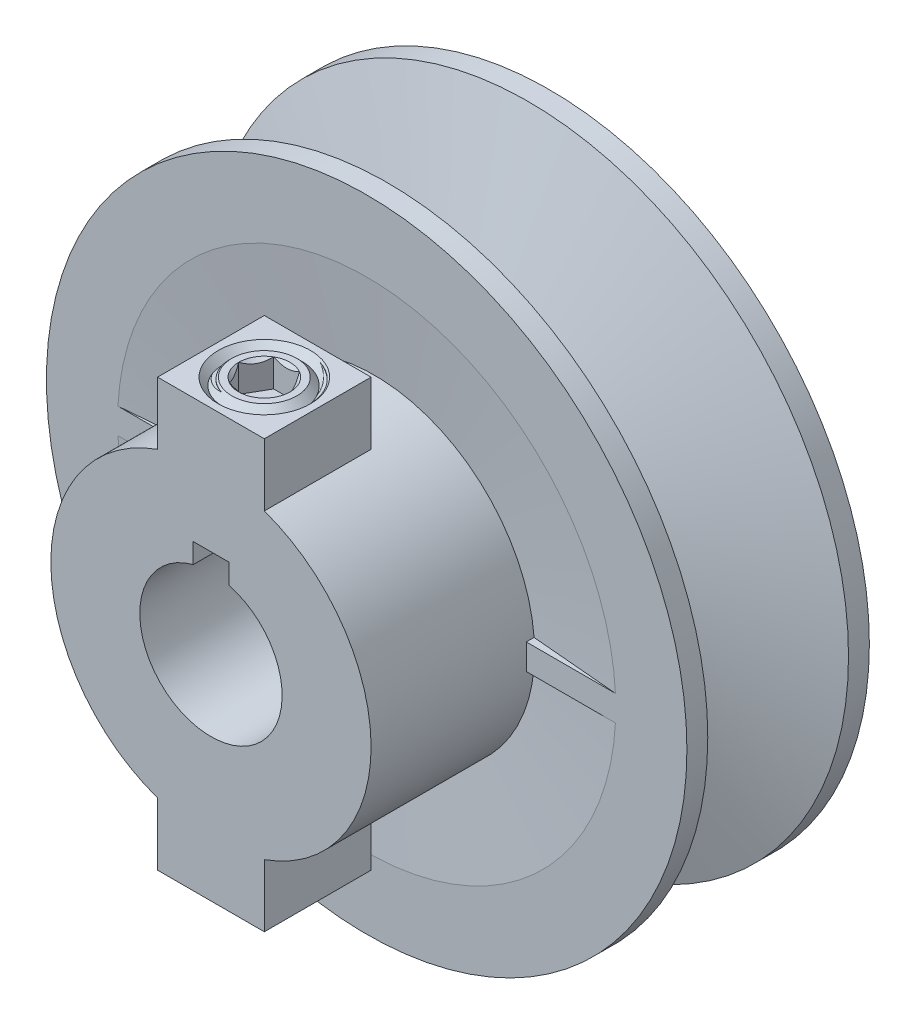
from build123d import *

# Parameters (mm, degrees)
BOSS_EXTRUDE1_DEPTH      = 1.143
CIRPATTERN1_COUNT        = 2
SKETCH3_R                = 6.35
CUT_EXTRUDE1_DEPTH       = 30.1752
BOSS_EXTRUDE2_REACH      = 62.791
BOSS_EXTRUDE2_END_RADIUS = 14.2875
BOSS_EXTRUDE2_START      = 4.7625
SKETCH5_W                = 9.525
SKETCH5_H                = 9.525
CUT_EXTRUDE3_REACH       = 61.751
CUT_EXTRUDE3_END_RADIUS  = 6.35
SKETCH6_R                = 3.0868055555555562
CUT_SWEEP1_PITCH         = 1.4111111111111094
CUT_SWEEP2_PITCH         = 1.4111111111111119
CUT_EXTRUDE5_DEPTH       = 2.48046875
SKETCH15_W               = 3.175
SKETCH15_H               = 2.980532838771275
CUT_EXTRUDE7_DEPTH       = 25.4


with BuildPart() as part:
    # Sketch1 → Revolve1 (revolve)
    with BuildSketch(Plane(origin=(0, 0, 0), x_dir=(0, 0, -1), z_dir=(1, 0, 0)), mode=Mode.PRIVATE) as revolve1_sk:
        Polygon((6.279294913631238, 28.575), (8.1407, 28.575000000000003), (8.1407, 22.225), (7.44625873326298, 14.287500000000003), (8.140700000000002, 14.2875), (8.140700000000004, 0), (-22.034499999999994, 0), (-22.03449999999999, 14.2875), (-7.746999999999997, 14.2875), (-7.446258733262977, 14.287500000000001), (-8.1407, 22.224999999999998), (-8.1407, 28.575), (-6.279294913631238, 28.575), (-2.3965152591062817, 15.875), (2.3965152591062844, 15.875), align=None)
    revolve(revolve1_sk.sketch.rotate(Axis((0, 0, 22.034499999999994), (0, 0, -1)), 90), axis=Axis((0, 0, 22.034499999999994), (0, 0, -1)))

    # Sketch2 → Boss-Extrude1 (add, symmetric)
    with BuildSketch(Plane(origin=(0, 0, 0), x_dir=(0, 0, -1), z_dir=(0, 1, 0))):
        Polygon((-7.4240366127273925, 14.033499999999998), (-8.1407, 22.225), (-8.1407, 14.0335), align=None)
        Polygon((8.1407, 14.0335), (7.4240366127273925, 14.033499999999998), (8.1407, 22.225), align=None)
    boss_extrude1 = extrude(amount=BOSS_EXTRUDE1_DEPTH, both=True)

    # CirPattern1: Boss-Extrude1 ×2 about axis
    cirpattern1_axis = Axis((0, 0, 0), (0, 0, -1))
    for i in range(1, CIRPATTERN1_COUNT):
        add(boss_extrude1.rotate(cirpattern1_axis, i * 360 / CIRPATTERN1_COUNT))

    # Sketch3 → Cut-Extrude1 (cut)
    with BuildSketch(Plane(origin=(0, 0, -8.1407), x_dir=(-1, 0, 0), z_dir=(0, 0, -1))):
        with Locations(Location((0, 2.6e-15, 0), (0, 0, 90))):
            Circle(SKETCH3_R)
    extrude(amount=-CUT_EXTRUDE1_DEPTH, mode=Mode.SUBTRACT)

    # Boss-Extrude2: up to this cylinder (the profile starts outside it)
    boss_extrude2_end = Plane(origin=(0, 0, 17.272), z_dir=(0, 0, 1)) * Cylinder(BOSS_EXTRUDE2_END_RADIUS, 155.15699999999998, mode=Mode.PRIVATE)
    # Sketch5 → Boss-Extrude2 (add, up to the surface)
    with BuildSketch(Plane(origin=(0, 14.2875, 0), x_dir=(-1, 0, 0), z_dir=(0, 1, 0)).offset(BOSS_EXTRUDE2_START), mode=Mode.PRIVATE) as boss_extrude2_sk1:
        with Locations((0, 17.271999999999995)):
            Rectangle(SKETCH5_W, SKETCH5_H)
    boss_extrude2_tool1 = extrude(boss_extrude2_sk1.sketch, amount=-BOSS_EXTRUDE2_REACH, mode=Mode.PRIVATE) - boss_extrude2_end
    boss_extrude2 = boss_extrude2_tool1.solids().sort_by_distance((0, 19.05, 17.272))[0]
    add(boss_extrude2)

    # Mirror1: Boss-Extrude2 across plane
    add(boss_extrude2.mirror(Plane.ZX))

    # Cut-Extrude3: up to this cylinder (the profile starts outside it)
    cut_extrude3_end = Plane(origin=(0, 2.6e-15, 17.272), z_dir=(0, 0, -1)) * Cylinder(CUT_EXTRUDE3_END_RADIUS, 137.202, mode=Mode.PRIVATE)
    # Sketch6 → Cut-Extrude3 (cut, up to the surface)
    with BuildSketch(Plane(origin=(0, 19.05, 0), x_dir=(-1, 0, 0), z_dir=(0, 1, 0)), mode=Mode.PRIVATE) as cut_extrude3_sk1:
        with Locations(Location((0, 17.271999999999995, 0), (0, 0, 90))):
            Circle(SKETCH6_R)
    cut_extrude3_tool1 = extrude(cut_extrude3_sk1.sketch, amount=-CUT_EXTRUDE3_REACH, mode=Mode.PRIVATE) - cut_extrude3_end
    add(cut_extrude3_tool1.solids().sort_by_distance((0, 19.05, 17.272))[0], mode=Mode.SUBTRACT)

    # Cut-Sweep1: arcs per turn and ends read off the stored shape
    # Cut-Sweep1: the profile of Sketch8 screwed along a right-hand helix through 11.125 turns, 8 arcs to a turn; built about Z, then put on its axis
    cut_sweep1_z = Axis((0, 0, 0), (0, 0, 1))
    cut_sweep1_corners = [(2.975827818, 0, -1.367013889), (2.975827818, 0, -0.044097222), (3.96875, 0, -0.617361111), (3.96875, 0, -0.79375)]
    with BuildLine(mode=Mode.PRIVATE) as cut_sweep1_profile:
        Line(cut_sweep1_corners[0], cut_sweep1_corners[1])
        Line(cut_sweep1_corners[1], cut_sweep1_corners[2])
        Line(cut_sweep1_corners[2], cut_sweep1_corners[3])
        Line(cut_sweep1_corners[3], cut_sweep1_corners[0])
    cut_sweep1_cap = Face(cut_sweep1_profile.wire())
    cut_sweep1_turn_angles = [0, 22.5, 45, 67.5, 90, 112.5, 135, 157.5, 180, 202.5, 225, 247.5, 270, 292.5, 315, 337.5, 360]
    cut_sweep1_turn_weights = [1, 0.9238795325112867, 1, 0.9238795325112867, 1, 0.9238795325112867, 1, 0.9238795325112867, 1, 0.9238795325112867, 1, 0.9238795325112867, 1, 0.9238795325112867, 1, 0.9238795325112867, 1]
    cut_sweep1_turn_rails = [Edge.make_bspline([Vector(p[0], p[1], 0).rotate(cut_sweep1_z, cut_sweep1_turn_angles[k]) / cut_sweep1_turn_weights[k] + Vector(0, 0, p[2] + CUT_SWEEP1_PITCH * cut_sweep1_turn_angles[k] / 360) for k in range(17)], [0, 0, 0, 1, 1, 2, 2, 3, 3, 4, 4, 5, 5, 6, 6, 7, 7, 8, 8, 8], 2, cut_sweep1_turn_weights) for p in cut_sweep1_corners]
    cut_sweep1_turn_sides = [Face.make_surface_from_curves(cut_sweep1_turn_rails[p[0]], cut_sweep1_turn_rails[p[1]]) for p in [(0, 1), (1, 2), (2, 3), (3, 0)]]
    cut_sweep1_last_angles = [3960, 3982.5, 4005]
    cut_sweep1_last_weights = [1, 0.9238795325112579, 1]
    cut_sweep1_last_rails = [Edge.make_bspline([Vector(p[0], p[1], 0).rotate(cut_sweep1_z, cut_sweep1_last_angles[k]) / cut_sweep1_last_weights[k] + Vector(0, 0, p[2] + CUT_SWEEP1_PITCH * cut_sweep1_last_angles[k] / 360) for k in range(3)], [0, 0, 0, 1, 1, 1], 2, cut_sweep1_last_weights) for p in cut_sweep1_corners]
    cut_sweep1_last_sides = [Face.make_surface_from_curves(cut_sweep1_last_rails[p[0]], cut_sweep1_last_rails[p[1]]) for p in [(0, 1), (1, 2), (2, 3), (3, 0)]]
    cut_sweep1 = Plane(origin=(0, 19.05, 17.271999999999995), x_dir=(0, 0, 1), z_dir=(0, -1, 0)) * Solid(Shell([*[p.moved(Location((0, 0, CUT_SWEEP1_PITCH * i))) for i in range(11) for p in cut_sweep1_turn_sides], *cut_sweep1_last_sides, cut_sweep1_cap, cut_sweep1_cap.rotate(cut_sweep1_z, 4005).moved(Location((0, 0, CUT_SWEEP1_PITCH * 4005 / 360)))]))
    add(cut_sweep1, mode=Mode.SUBTRACT)

    # Cut-Extrude4 cone 1 section (through the dimple's axis) → Cut-Extrude4 (revolve, cut)
    with BuildSketch(Plane(origin=(0, 19.05, 17.272), x_dir=(0, 0, 1), z_dir=(1, 0, 0))):
        Polygon((0, 0), (4.121507259, 0), (0, 4.121507259), align=None)
    revolve(axis=Axis((0, 19.05, 17.272), (0, -1, 0)), mode=Mode.SUBTRACT)


with BuildPart() as body_2:
    # Sketch10 → Revolve3 (revolve)
    with BuildSketch(Plane(origin=(0, 0, 0), x_dir=(0, 0, -1), z_dir=(1, 0, 0))):
        Polygon((-21.240749999999995, 7.419300811061629), (-21.240749999999995, 17.98069918893837), (-20.171449188938364, 19.05), (-17.271999999999995, 19.05), (-17.271999999999995, 6.350000000000001), (-20.171449188938364, 6.3500000000000005), align=None)
    revolve(axis=Axis((0, 19.05, 17.271999999999995), (0, -1, 0)))

    # Cut-Sweep2: arcs per turn and ends read off the stored shape
    # Cut-Sweep2: the profile of Sketch12 screwed along a right-hand helix through 10 turns, 8 arcs to a turn; built about Z, then put on its axis
    cut_sweep2_z = Axis((0, 0, 0), (0, 0, 1))
    cut_sweep2_corners = [(4.045128629, 0, -0.661458333), (4.045128629, 0, 0.661458333), (3.052206448, 0, 0.088194444), (3.052206448, 0, -0.088194444)]
    with BuildLine(mode=Mode.PRIVATE) as cut_sweep2_profile:
        Line(cut_sweep2_corners[0], cut_sweep2_corners[1])
        Line(cut_sweep2_corners[1], cut_sweep2_corners[2])
        Line(cut_sweep2_corners[2], cut_sweep2_corners[3])
        Line(cut_sweep2_corners[3], cut_sweep2_corners[0])
    cut_sweep2_cap = Face(cut_sweep2_profile.wire())
    cut_sweep2_turn_angles = [0, 22.5, 45, 67.5, 90, 112.5, 135, 157.5, 180, 202.5, 225, 247.5, 270, 292.5, 315, 337.5, 360]
    cut_sweep2_turn_weights = [1, 0.9238795325112867, 1, 0.9238795325112867, 1, 0.9238795325112867, 1, 0.9238795325112867, 1, 0.9238795325112867, 1, 0.9238795325112867, 1, 0.9238795325112867, 1, 0.9238795325112867, 1]
    cut_sweep2_turn_rails = [Edge.make_bspline([Vector(p[0], p[1], 0).rotate(cut_sweep2_z, cut_sweep2_turn_angles[k]) / cut_sweep2_turn_weights[k] + Vector(0, 0, p[2] + CUT_SWEEP2_PITCH * cut_sweep2_turn_angles[k] / 360) for k in range(17)], [0, 0, 0, 1, 1, 2, 2, 3, 3, 4, 4, 5, 5, 6, 6, 7, 7, 8, 8, 8], 2, cut_sweep2_turn_weights) for p in cut_sweep2_corners]
    cut_sweep2_turn_sides = [Face.make_surface_from_curves(cut_sweep2_turn_rails[p[0]], cut_sweep2_turn_rails[p[1]]) for p in [(0, 1), (1, 2), (2, 3), (3, 0)]]
    cut_sweep2 = Plane(origin=(0, 19.05, 17.271999999999995), x_dir=(0, 0, 1), z_dir=(0, -1, 0)) * Solid(Shell([*[p.moved(Location((0, 0, CUT_SWEEP2_PITCH * i))) for i in range(10) for p in cut_sweep2_turn_sides], cut_sweep2_cap, cut_sweep2_cap.rotate(cut_sweep2_z, 3600).moved(Location((0, 0, CUT_SWEEP2_PITCH * 3600 / 360)))]))
    add(cut_sweep2, mode=Mode.SUBTRACT)

    # Sketch13 → Cut-Extrude5 (cut)
    with BuildSketch(Plane(origin=(0, 19.05, 0), x_dir=(1, 0, 0), z_dir=(0, 1, 0))):
        Polygon((2.2913588808463268, -17.271999999999995), (1.1456794404231658, -15.287624999999995), (-1.1456794404231585, -15.287624999999995), (-2.291358880846323, -17.271999999999988), (-1.1456794404231627, -19.25637499999999), (1.1456794404231625, -19.256374999999995), align=None)
    extrude(amount=-CUT_EXTRUDE5_DEPTH, mode=Mode.SUBTRACT)

    # Cut-Extrude6 cone 1 section (through the dimple's axis) → Cut-Extrude6 (revolve, cut)
    with BuildSketch(Plane(origin=(0, 19.05, 17.272), x_dir=(0, 0, 1), z_dir=(1, 0, 0))):
        Polygon((0, 0), (2.291358881, 0), (0, 2.291358881), align=None)
    revolve(axis=Axis((0, 19.05, 17.272), (0, -1, 0)), mode=Mode.SUBTRACT)


with BuildPart() as cut_extrude7_tool:
    # Sketch15 → Cut-Extrude7 (new body)
    with BuildSketch(Plane.XY.offset(22.03449999999999)):
        with Locations((4.4e-16, 6.447233580614366)):
            Rectangle(SKETCH15_W, SKETCH15_H)
    extrude(amount=-CUT_EXTRUDE7_DEPTH)


with BuildPart() as part_1:
    add(part.part)

    # Cut-Extrude7: cut by cut_extrude7_tool
    add(cut_extrude7_tool.part, mode=Mode.SUBTRACT)


with BuildPart() as body_2_1:
    add(body_2.part)

    # Cut-Extrude7: cut by cut_extrude7_tool
    add(cut_extrude7_tool.part, mode=Mode.SUBTRACT)


solid = Compound([part_1.part, body_2_1.part])
